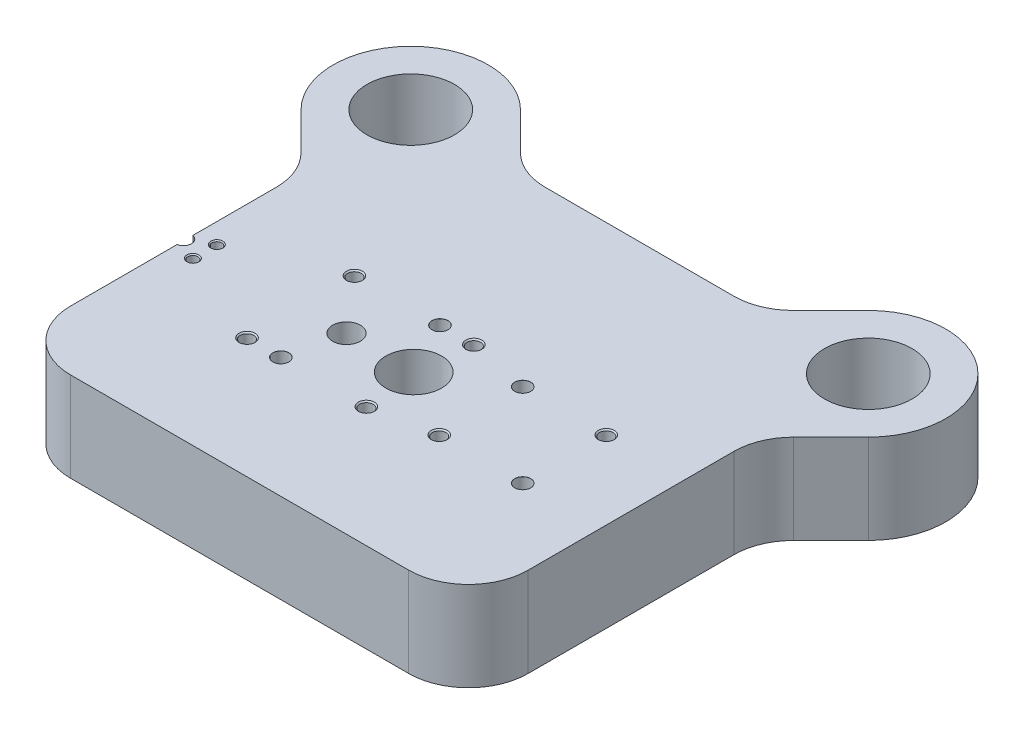
from build123d import *

# Parameters (mm, degrees)
BOSS_EXTRUDE1_DEPTH        = 45
FILLET1_R                  = 30
CUT_EXTRUDE1_REACH         = 202.352
SKETCH2_R                  = 22
FILLET2_R                  = 30
M30X2_0_TAPPED_HOLE1_D     = 28
M30X2_0_TAPPED_HOLE1_DEPTH = 35
M30X2_0_TAPPED_HOLE1_TIP   = 8.412048666
SKETCH5_R                  = 7
CUT_EXTRUDE2_DEPTH         = 201.352189906
SKETCH6_W                  = 30
SKETCH6_H                  = 25
CUT_EXTRUDE3_DEPTH         = 10
FILLET3_R                  = 5
M6_TAPPED_HOLE1_AT_2_COUNT = 2
M6_TAPPED_HOLE1_AT_2_PITCH = 12
CUT_EXTRUDE4_REACH         = 202.352
SKETCH9_R                  = 4


# Read off the part's stored shape, not the designer's step: M8 Tapped Hole1, Ø8.0mm Dowel Hole1, M8 Tapped Hole2, Ø8.0mm Dowel Hole2
with BuildPart() as part:
    # Sketch1 → Boss-Extrude1 (new body)
    with BuildSketch(Plane(origin=(0, 0, 0), x_dir=(1, 0, 0), z_dir=(0, 1, 0))):
        with BuildLine():
            Line((-142.577164466, 53.422835534), (-115, 25.845671067))
            Line((-115, 25.845671067), (-115, -120))
            Line((-115, -120), (115, -120))
            Line((115, -120), (115, 25.845671067))
            Line((115, 25.845671067), (142.577164466, 53.422835534))
            ThreePointArc((142.577164466, 53.422835534), (142.577164466, 108.577164466), (87.422835534, 108.577164466))
            Line((87.422835534, 108.577164466), (59.845671067, 81))
            Line((59.845671067, 81), (-59.845671067, 81))
            Line((-59.845671067, 81), (-87.422835534, 108.577164466))
            ThreePointArc((-87.422835534, 108.577164466), (-142.577164466, 108.577164466), (-142.577164466, 53.422835534))
        make_face()
    extrude(amount=-BOSS_EXTRUDE1_DEPTH)

    # Fillet1
    fillet1_edges = [part.edges().sort_by_distance(p)[0] for p in [
        (-59.845671067, -22.5, -81),
        (59.845671067, -22.5, -81),
        (115, -22.5, -25.845671067),
        (-115, -22.5, -25.845671067),
    ]]
    fillet(fillet1_edges, radius=FILLET1_R)

    # Sketch2 → Cut-Extrude1 (cut, up to next)
    with BuildSketch(Plane(origin=(0, 0, 0), x_dir=(1, 0, 0), z_dir=(0, 1, 0)), mode=Mode.PRIVATE) as cut_extrude1_sk1:
        with Locations(Location((-115, 81, 0), (0, 0, 270))):
            Circle(SKETCH2_R)
    cut_extrude1_tool1 = extrude(cut_extrude1_sk1.sketch, amount=-CUT_EXTRUDE1_REACH, mode=Mode.PRIVATE) & part.part
    # Sketch2 → Cut-Extrude1 (cut, up to next)
    with BuildSketch(Plane(origin=(0, 0, 0), x_dir=(1, 0, 0), z_dir=(0, 1, 0)), mode=Mode.PRIVATE) as cut_extrude1_sk2:
        with Locations(Location((115, 81, 0), (0, 0, 270))):
            Circle(SKETCH2_R)
    cut_extrude1_tool2 = extrude(cut_extrude1_sk2.sketch, amount=-CUT_EXTRUDE1_REACH, mode=Mode.PRIVATE) & part.part
    add(cut_extrude1_tool1.solids().sort_by_distance((-115, 0, -81))[0], mode=Mode.SUBTRACT)
    add(cut_extrude1_tool2.solids().sort_by_distance((115, 0, -81))[0], mode=Mode.SUBTRACT)

    # Fillet2
    fillet2_edges = [part.edges().sort_by_distance(p)[0] for p in [
        (115, -22.5, 120),
        (-115, -22.5, 120),
    ]]
    fillet(fillet2_edges, radius=FILLET2_R)

    # M30x2.0 Tapped Hole1
    with Locations(Plane(origin=(0, 0, 0), x_dir=(1, 0, 0), z_dir=(0, 1, 0))):
        with Locations((0, -32.5)):
            Hole(M30X2_0_TAPPED_HOLE1_D / 2, depth=M30X2_0_TAPPED_HOLE1_DEPTH)
            with Locations((0, 0, -(M30X2_0_TAPPED_HOLE1_DEPTH + M30X2_0_TAPPED_HOLE1_TIP / 2))):  # 118° drill point
                Cone(0, M30X2_0_TAPPED_HOLE1_D / 2, M30X2_0_TAPPED_HOLE1_TIP, mode=Mode.SUBTRACT)

    # Sketch5 → Cut-Extrude2 (cut, through all)
    with BuildSketch(Plane(origin=(0, 0, 0), x_dir=(1, 0, 0), z_dir=(0, 1, 0))):
        with Locations(Location((-33.8, -32.5, 0), (0, 0, 270))):
            Circle(SKETCH5_R)
        with Locations(Location((4.2, -32.5, 0), (0, 0, 270))):
            Circle(SKETCH5_R)
    extrude(amount=-CUT_EXTRUDE2_DEPTH, mode=Mode.SUBTRACT)

    # Sketch6 → Cut-Extrude3 (cut)
    with BuildSketch(Plane.XZ.offset(45)):
        with Locations((-110, 32.5)):
            Rectangle(SKETCH6_W, SKETCH6_H)
    extrude(amount=-CUT_EXTRUDE3_DEPTH, mode=Mode.SUBTRACT)

    # Fillet3
    fillet3_edges = [part.edges().sort_by_distance(p)[0] for p in [
        (-95, -40, 45),
        (-95, -40, 20),
    ]]
    fillet(fillet3_edges, radius=FILLET3_R)

    # Sketch8 → M6 Tapped Hole1 (revolve, cut)
    with BuildSketch(Plane(origin=(-105, -35, 26.5), x_dir=(0, 0, -1), z_dir=(1, 0, 0))):
        Polygon((0, 0), (0, 35), (3.025, 35), (2.5, 34.475), (2.5, 0.525), (3.025, 0), align=None)
    m6_tapped_hole1 = revolve(axis=Axis((-105, -41.35, 26.5), (0, 1, 0)), mode=Mode.SUBTRACT)

    # M6 Tapped Hole1 at 2: M6 Tapped Hole1 ×2
    with Locations(*[(0, 0, i * M6_TAPPED_HOLE1_AT_2_PITCH) for i in range(1, M6_TAPPED_HOLE1_AT_2_COUNT)]):
        add(m6_tapped_hole1, mode=Mode.SUBTRACT)

    # Sketch9 → Cut-Extrude4 (cut, up to next)
    with BuildSketch(Plane(origin=(0, 0, 0), x_dir=(1, 0, 0), z_dir=(0, 1, 0)), mode=Mode.PRIVATE) as cut_extrude4_sk1:
        with Locations((-115.715161352, -32.5)):
            Circle(SKETCH9_R)
    cut_extrude4_tool1 = extrude(cut_extrude4_sk1.sketch, amount=-CUT_EXTRUDE4_REACH, mode=Mode.PRIVATE) & part.part
    add(cut_extrude4_tool1.solids().sort_by_distance((-115.715161, 0, 32.5))[0], mode=Mode.SUBTRACT)

    # M8 Tapped Hole1 outline → M8 Tapped Hole1 (revolve, cut)
    with BuildSketch(Plane(origin=(-56.8, 0, 59.5), x_dir=(1, 0, 0), z_dir=(0, 0, 1))):
        Polygon((4.025, 0), (0, 0), (0, -45), (4.025, -45), (3.4, -44.375), (3.4, -0.625), align=None)
    revolve(axis=Axis((-56.8, 0, 59.5), (0, 1, 0)), mode=Mode.SUBTRACT)

    # M8 Tapped Hole1 2 outline → M8 Tapped Hole1 2 (revolve, cut)
    with BuildSketch(Plane(origin=(3.2, 0, 59.5), x_dir=(1, 0, 0), z_dir=(0, 0, 1))):
        Polygon((4.025, 0), (0, 0), (0, -45), (4.025, -45), (3.4, -44.375), (3.4, -0.625), align=None)
    revolve(axis=Axis((3.2, 0, 59.5), (0, 1, 0)), mode=Mode.SUBTRACT)

    # M8 Tapped Hole1 3 outline → M8 Tapped Hole1 3 (revolve, cut)
    with BuildSketch(Plane(origin=(3.2, 0, 5.5), x_dir=(1, 0, 0), z_dir=(0, 0, 1))):
        Polygon((4.025, 0), (0, 0), (0, -45), (4.025, -45), (3.4, -44.375), (3.4, -0.625), align=None)
    revolve(axis=Axis((3.2, 0, 5.5), (0, 1, 0)), mode=Mode.SUBTRACT)

    # M8 Tapped Hole1 4 outline → M8 Tapped Hole1 4 (revolve, cut)
    with BuildSketch(Plane(origin=(-56.8, 0, 5.5), x_dir=(1, 0, 0), z_dir=(0, 0, 1))):
        Polygon((4.025, 0), (0, 0), (0, -45), (4.025, -45), (3.4, -44.375), (3.4, -0.625), align=None)
    revolve(axis=Axis((-56.8, 0, 5.5), (0, 1, 0)), mode=Mode.SUBTRACT)

    # Ø8.0mm Dowel Hole1 outline → Ø8.0mm Dowel Hole1 (revolve, cut)
    with BuildSketch(Plane(origin=(-39.8, 0, 59.5), x_dir=(1, 0, 0), z_dir=(0, 0, 1))):
        Polygon((0, -45), (4.025, -45), (4, -44.975), (4, -0.025), (4.025, 0), (0, 0), align=None)
    revolve(axis=Axis((-39.8, 0, 59.5), (0, 1, 0)), mode=Mode.SUBTRACT)

    # 8.0mm Dowel Hole1 2 outline → 8.0mm Dowel Hole1 2 (revolve, cut)
    with BuildSketch(Plane(origin=(-13.8, 0, 5.5), x_dir=(1, 0, 0), z_dir=(0, 0, 1))):
        Polygon((0, -45), (4.025, -45), (4, -44.975), (4, -0.025), (4.025, 0), (0, 0), align=None)
    revolve(axis=Axis((-13.8, 0, 5.5), (0, 1, 0)), mode=Mode.SUBTRACT)

    # M8 Tapped Hole2 outline → M8 Tapped Hole2 (revolve, cut)
    with BuildSketch(Plane(origin=(75.8, 0, 11.5), x_dir=(1, 0, 0), z_dir=(0, 0, 1))):
        Polygon((4.025, 0), (0, 0), (0, -45), (4.025, -45), (3.4, -44.375), (3.4, -0.625), align=None)
    revolve(axis=Axis((75.8, 0, 11.5), (0, 1, 0)), mode=Mode.SUBTRACT)

    # M8 Tapped Hole2 2 outline → M8 Tapped Hole2 2 (revolve, cut)
    with BuildSketch(Plane(origin=(33.8, 0, 53.5), x_dir=(1, 0, 0), z_dir=(0, 0, 1))):
        Polygon((4.025, 0), (0, 0), (0, -45), (4.025, -45), (3.4, -44.375), (3.4, -0.625), align=None)
    revolve(axis=Axis((33.8, 0, 53.5), (0, 1, 0)), mode=Mode.SUBTRACT)

    # Ø8.0mm Dowel Hole2 outline → Ø8.0mm Dowel Hole2 (revolve, cut)
    with BuildSketch(Plane(origin=(75.8, 0, 53.5), x_dir=(1, 0, 0), z_dir=(0, 0, 1))):
        Polygon((4.025, 0), (0, 0), (0, -45), (4.025, -45), (4, -44.975), (4, -0.025), align=None)
    revolve(axis=Axis((75.8, 0, 53.5), (0, 1, 0)), mode=Mode.SUBTRACT)

    # 8.0mm Dowel Hole2 2 outline → 8.0mm Dowel Hole2 2 (revolve, cut)
    with BuildSketch(Plane(origin=(33.8, 0, 11.5), x_dir=(1, 0, 0), z_dir=(0, 0, 1))):
        Polygon((4.025, 0), (0, 0), (0, -45), (4.025, -45), (4, -44.975), (4, -0.025), align=None)
    revolve(axis=Axis((33.8, 0, 11.5), (0, 1, 0)), mode=Mode.SUBTRACT)


solid = part.part
